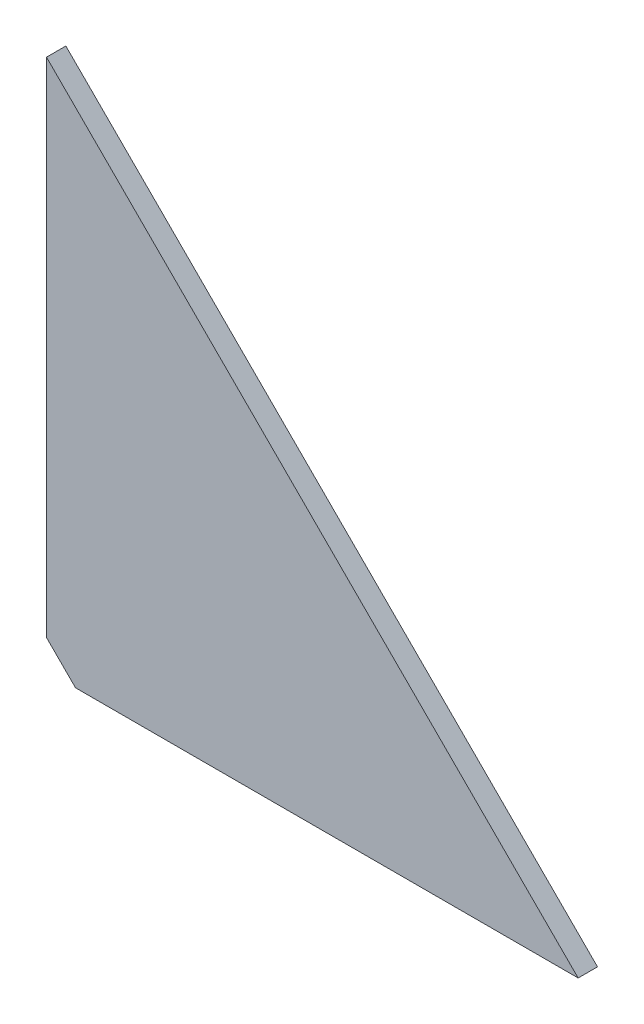
from build123d import *

# Parameters (mm, degrees)
SM_BASE_FLANGE_1_DEPTH = 4
CHAMFER_1_SIZE         = 6


# Sheet-metal steps are written as plain solids
with BuildPart() as part:
    # Sketch 1 → Базовая кромка1 (new body)
    with BuildSketch(Plane.XY):
        Polygon((0, 110), (0, 0), (110, 0), align=None)
    extrude(amount=-SM_BASE_FLANGE_1_DEPTH)

    # Фаска1
    chamfer_1_edges = [part.edges().sort_by_distance(p)[0] for p in [
        (0, 0, -2),
    ]]
    chamfer(chamfer_1_edges, length=CHAMFER_1_SIZE)


solid = part.part
